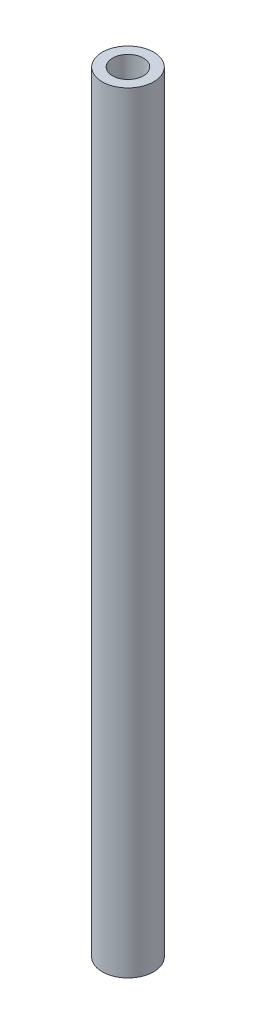
from build123d import *

# Parameters (mm, degrees)
SKETCH1_R           = 2.5
SKETCH1_R_2         = 1.5
BOSS_EXTRUDE1_DEPTH = 75


with BuildPart() as part:
    # Sketch1 → Boss-Extrude1 (new body)
    with BuildSketch(Plane(origin=(0, 0, 0), x_dir=(1, 0, 0), z_dir=(0, 1, 0))):
        Circle(SKETCH1_R)
        Circle(SKETCH1_R_2, mode=Mode.SUBTRACT)
    extrude(amount=BOSS_EXTRUDE1_DEPTH)


solid = part.part
